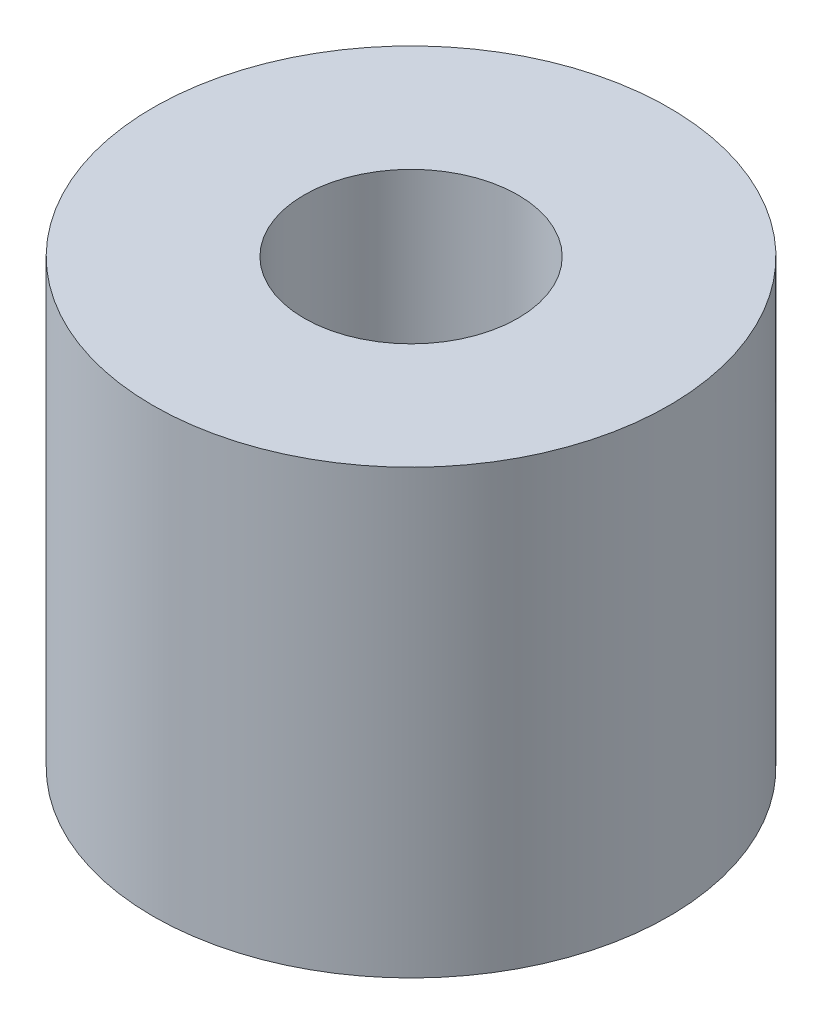
from build123d import *

# Parameters (mm, degrees)
SKETCH1_R              = 3.5
BOSS_EXTRUDE1_DEPTH    = 6
M2_5_CLEARANCE_HOLE1_D = 2.9


with BuildPart() as part:
    # Sketch1 → Boss-Extrude1 (new body)
    with BuildSketch(Plane(origin=(0, 0, 0), x_dir=(1, 0, 0), z_dir=(0, 1, 0))):
        Circle(SKETCH1_R)
    extrude(amount=BOSS_EXTRUDE1_DEPTH)

    # M2.5 Clearance Hole1 (through all)
    with Locations(Plane.ZX.offset(6)):
        with Locations((0, 0)):
            Hole(M2_5_CLEARANCE_HOLE1_D / 2)


solid = part.part
